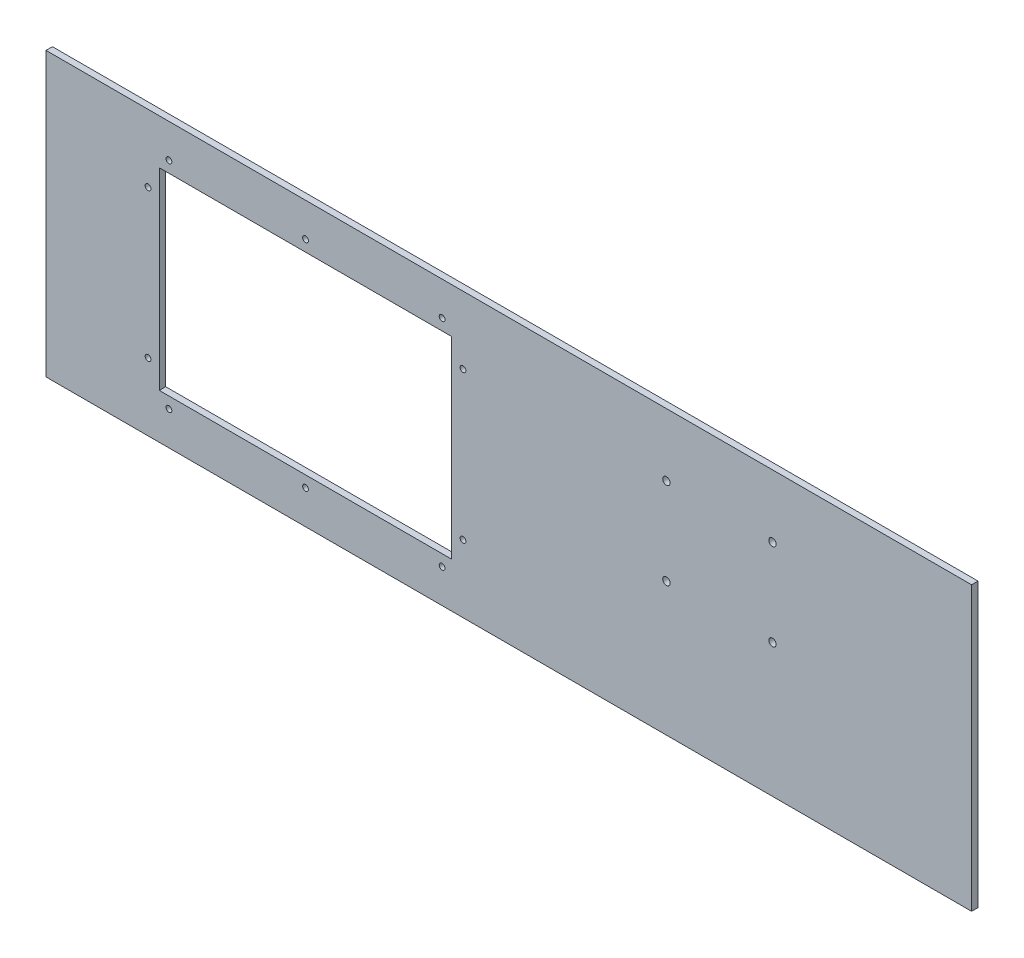
from build123d import *

# Parameters (mm, degrees)
IZIM1_W               = 1440
IZIM1_H               = 440
TABAN_FLAN_1_DEPTH    = 10
IZIM2_W               = 455
IZIM2_H               = 300
KES_EKSTR_ZYON1_DEPTH = 753.927619363
IZIM4_R               = 4.5
KES_EKSTR_ZYON3_DEPTH = 753.927619363
IZIM5_R               = 5.75
KES_EKSTR_ZYON4_DEPTH = 10


# Sheet-metal steps are written as plain solids
with BuildPart() as part:
    # Çizim1 → Taban-Flanş1 (new body)
    with BuildSketch(Plane.XY):
        Rectangle(IZIM1_W, IZIM1_H)
    extrude(amount=-TABAN_FLAN_1_DEPTH)

    # Çizim2 → Kes-Ekstrüzyon1 (cut, through all)
    with BuildSketch(Plane(origin=(0, 0, -10), x_dir=(-1, 0, 0), z_dir=(0, 0, -1))):
        with Locations((316.25, 0)):
            Rectangle(IZIM2_W, IZIM2_H)
    extrude(amount=-KES_EKSTR_ZYON1_DEPTH, mode=Mode.SUBTRACT)

    # Çizim4 → Kes-Ekstrüzyon3 (cut, through all)
    with BuildSketch(Plane(origin=(0, 0, -10), x_dir=(-1, 0, 0), z_dir=(0, 0, -1))):
        with Locations((71.25, -115)):
            Circle(IZIM4_R)
        with Locations((316.25, -167.5)):
            Circle(IZIM4_R)
        with Locations((528.75, -167.5)):
            Circle(IZIM4_R)
        with Locations((561.25, -115)):
            Circle(IZIM4_R)
        with Locations((561.25, 115)):
            Circle(IZIM4_R)
        with Locations((528.75, 167.5)):
            Circle(IZIM4_R)
        with Locations((316.25, 167.5)):
            Circle(IZIM4_R)
        with Locations((103.75, 167.5)):
            Circle(IZIM4_R)
        with Locations((71.25, 115)):
            Circle(IZIM4_R)
    kes_ekstr_zyon3 = extrude(amount=-KES_EKSTR_ZYON3_DEPTH, mode=Mode.SUBTRACT)

    # Aynalama1: Kes-Ekstrüzyon3 across plane
    add(kes_ekstr_zyon3.mirror(Plane.ZX), mode=Mode.SUBTRACT)

    # Çizim5 → Kes-Ekstrüzyon4 (cut)
    with BuildSketch(Plane.XY):
        with Locations((245.25, -12.5)):
            Circle(IZIM5_R)
        with Locations((245.25, 122.5)):
            Circle(IZIM5_R)
        with Locations((410.25, 122.5)):
            Circle(IZIM5_R)
        with Locations((410.25, -12.5)):
            Circle(IZIM5_R)
    extrude(amount=-KES_EKSTR_ZYON4_DEPTH, mode=Mode.SUBTRACT)


solid = part.part
